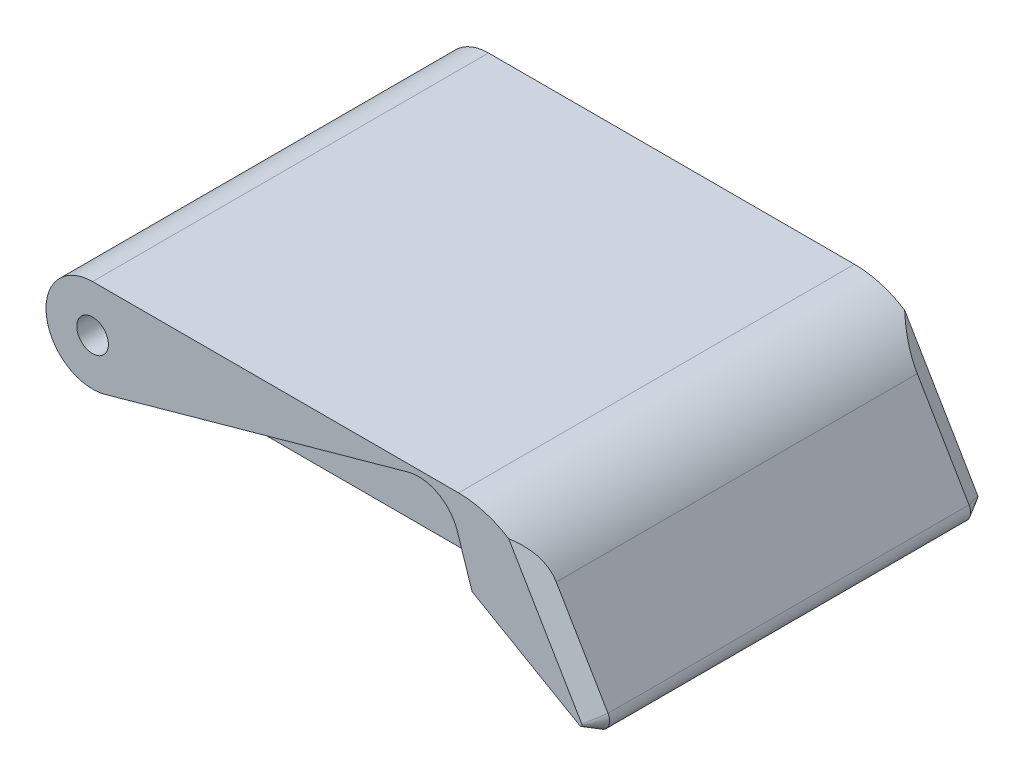
from build123d import *
from OCP.BRepFilletAPI import BRepFilletAPI_MakeChamfer

# Parameters (mm, degrees)
BOSS_EXTRUDE1_DEPTH = 26.9875
SKETCH2_R           = 2.159
SKETCH2_R_2         = 1.905
CUT_EXTRUDE1_DEPTH  = 91.763896577
CUT_EXTRUDE2_DEPTH  = 6.35
FILLET1_R           = 1.5875
CHAMFER2_SIZE       = 2.381123
CHAMFER2_SIZE2      = 1.374742005
CHAMFER3_SIZE       = 2.38125
CHAMFER3_SIZE2      = 1.374815329
FILLET2_R           = 12.7


with BuildPart() as part:
    # Sketch1 → Boss-Extrude1 (new, symmetric)
    with BuildSketch(Plane.XY):
        with BuildLine():
            Line((0, 6.35), (57.15, 6.35))
            Line((57.15, 6.35), (70.947506935, -17.065625))
            Line((70.947506935, -17.065625), (52.3875, -6.35))
            Line((52.3875, -6.35), (0, -6.35))
            ThreePointArc((0, -6.35), (-6.35, 0), (0, 6.35))
        make_face()
    extrude(amount=BOSS_EXTRUDE1_DEPTH, both=True)

    # Sketch2 → Cut-Extrude1 (cut, through all)
    with BuildSketch(Plane.XY.offset(26.9875)):
        Circle(SKETCH2_R)
        with Locations((44.45, 0)):
            Circle(SKETCH2_R_2)
    extrude(amount=-CUT_EXTRUDE1_DEPTH, mode=Mode.SUBTRACT)

    # Sketch3 → Cut-Extrude2 (cut)
    with BuildSketch(Plane.XY.offset(26.9875)):
        with BuildLine():
            Line((1.700892857, -6.117962364), (42.96171875, 5.353217069))
            ThreePointArc((42.96171875, 5.353217069), (47.069524942, 4.900000321), (49.728113691, 1.735923364))
            Line((49.728113691, 1.735923364), (52.3875, -6.35))
            Line((52.3875, -6.35), (0, -6.35))
            ThreePointArc((0, -6.35), (0.858323653, -6.291723175), (1.700892857, -6.117962364))
        make_face()
    cut_extrude2 = extrude(amount=-CUT_EXTRUDE2_DEPTH, mode=Mode.SUBTRACT)

    # Mirror1: Cut-Extrude2 across plane
    add(cut_extrude2.mirror(Plane.XY), mode=Mode.SUBTRACT)

    # Fillet1
    fillet1_edges = [part.edges().sort_by_distance(p)[0] for p in [
        (70.947506935, -17.065625, 0),
    ]]
    fillet(fillet1_edges, radius=FILLET1_R)

    # Chamfer2: one chamfer whose edges measure the first distance from different faces: ONE call of the kernel's chamfer builder (chamfer() names one face for all edges)
    chamfer2_edges_1 = [part.edges().sort_by_distance(p)[0] for p in [
        (62.5177482, -2.759557222, 26.9875),
    ]]
    chamfer2_side_1 = [part.faces().sort_by_distance(p)[0] for p in [
        (62.5177482, -2.759557222, 0),
    ]]
    chamfer2_edges_2 = [part.edges().sort_by_distance(p)[0] for p in [
        (67.645280547, -13.792573494, 26.9875),
    ]]
    chamfer2_side_2 = [part.faces().sort_by_distance(p)[0] for p in [
        (67.645280547, -13.792573494, 0),
    ]]
    chamfer2_edges_3 = [part.edges().sort_by_distance(p)[0] for p in [
        (59.055764446, -10.199924273, 26.9875),
    ]]
    chamfer2_side_3 = [part.faces().sort_by_distance(p)[0] for p in [
        (59.055764446, -10.199924273, 0),
    ]]
    chamfer2 = BRepFilletAPI_MakeChamfer(part.part.solid().wrapped)
    for e in chamfer2_edges_1:
        chamfer2.Add(CHAMFER2_SIZE, CHAMFER2_SIZE2, e.wrapped, chamfer2_side_1[0].wrapped)  # the first distance lies on this face
    for e in chamfer2_edges_2:
        chamfer2.Add(CHAMFER2_SIZE, CHAMFER2_SIZE2, e.wrapped, chamfer2_side_2[0].wrapped)  # the first distance lies on this face
    for e in chamfer2_edges_3:
        chamfer2.Add(CHAMFER2_SIZE, CHAMFER2_SIZE2, e.wrapped, chamfer2_side_3[0].wrapped)  # the first distance lies on this face
    add(Compound.cast(chamfer2.Shape()), mode=Mode.REPLACE)

    # Chamfer3: one chamfer whose edges measure the first distance from different faces: ONE call of the kernel's chamfer builder (chamfer() names one face for all edges)
    chamfer3_edges_1 = [part.edges().sort_by_distance(p)[0] for p in [
        (62.5177482, -2.759557222, -26.9875),
    ]]
    chamfer3_side_1 = [part.faces().sort_by_distance(p)[0] for p in [
        (62.5177482, -2.759557222, -1.1905615),
    ]]
    chamfer3_edges_2 = [part.edges().sort_by_distance(p)[0] for p in [
        (67.645280547, -13.792573494, -26.9875),
    ]]
    chamfer3_side_2 = [part.faces().sort_by_distance(p)[0] for p in [
        (67.645280547, -13.792573494, -1.1905615),
    ]]
    chamfer3_edges_3 = [part.edges().sort_by_distance(p)[0] for p in [
        (59.055764446, -10.199924273, -26.9875),
    ]]
    chamfer3_side_3 = [part.faces().sort_by_distance(p)[0] for p in [
        (59.055764446, -10.199924273, -1.1905615),
    ]]
    chamfer3 = BRepFilletAPI_MakeChamfer(part.part.solid().wrapped)
    for e in chamfer3_edges_1:
        chamfer3.Add(CHAMFER3_SIZE, CHAMFER3_SIZE2, e.wrapped, chamfer3_side_1[0].wrapped)  # the first distance lies on this face
    for e in chamfer3_edges_2:
        chamfer3.Add(CHAMFER3_SIZE, CHAMFER3_SIZE2, e.wrapped, chamfer3_side_2[0].wrapped)  # the first distance lies on this face
    for e in chamfer3_edges_3:
        chamfer3.Add(CHAMFER3_SIZE, CHAMFER3_SIZE2, e.wrapped, chamfer3_side_3[0].wrapped)  # the first distance lies on this face
    add(Compound.cast(chamfer3.Shape()), mode=Mode.REPLACE)

    # Fillet2
    fillet2_edges = [part.edges().sort_by_distance(p)[0] for p in [
        (57.15, 6.35, 6.35e-05),
    ]]
    fillet(fillet2_edges, radius=FILLET2_R)


solid = part.part
